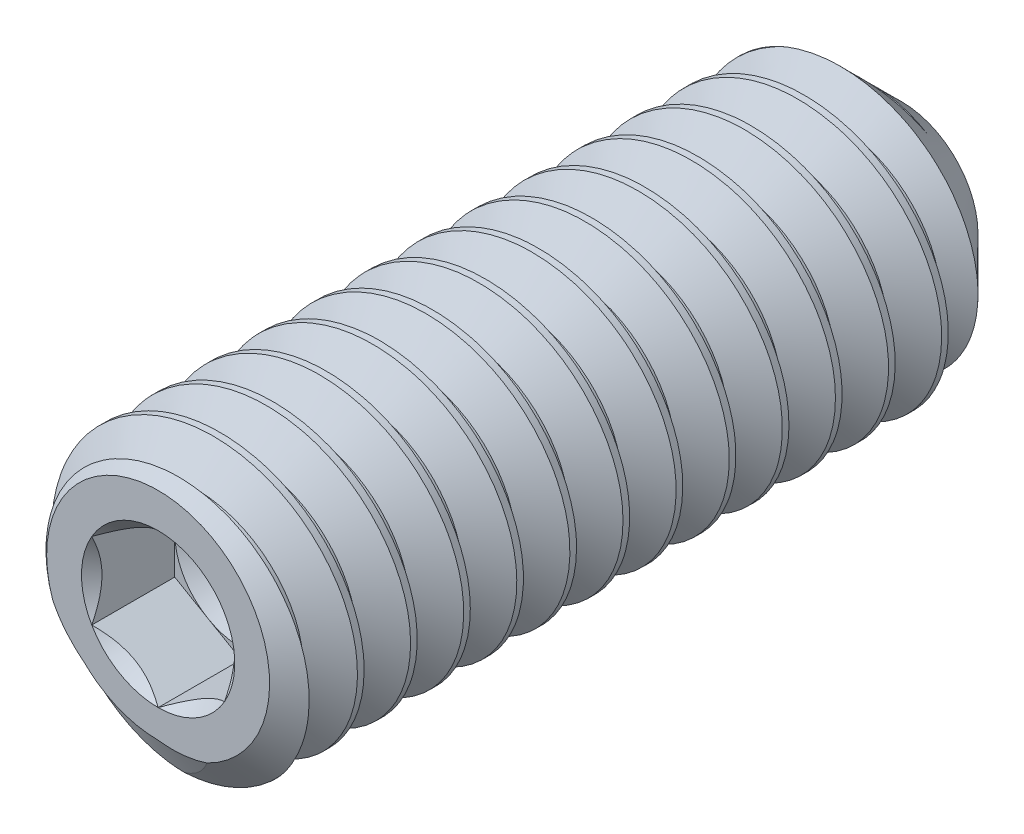
from build123d import *

# Parameters (mm, degrees)
CUT_EXTRUDE10_DEPTH = 1.240234375
CUT_SWEEP1_PITCH    = 0.79375


with BuildPart() as part:
    # Sketch22 → Revolve1 (revolve)
    with BuildSketch(Plane(origin=(0, 0, 0), x_dir=(0, 0, -1), z_dir=(1, 0, 0)), mode=Mode.PRIVATE) as revolve1_sk:
        Polygon((-5.213368495, 0), (-5.213368495, 1.66624), (-4.921690043, 2.0828), (4.957632812, 2.0828), (5.899131505, 1.141301307), (5.213368495, 0), align=None)
    revolve(revolve1_sk.sketch.rotate(Axis((0, 0, -5.213368495), (0, 0, -1)), 180), axis=Axis((0, 0, -5.213368495), (0, 0, -1)))

    # Sketch23 → Cut-Extrude10 (cut)
    with BuildSketch(Plane.XY.offset(5.213368495)):
        Polygon((0, 1.14567944), (-0.9921875, 0.57283972), (-0.9921875, -0.57283972), (0, -1.14567944), (0.9921875, -0.57283972), (0.9921875, 0.57283972), align=None)
    extrude(amount=-CUT_EXTRUDE10_DEPTH, mode=Mode.SUBTRACT)

    # Cut-Extrude11 cone 1 section (through the dimple's axis) → Cut-Extrude11 (revolve, cut)
    with BuildSketch(Plane(origin=(0, 0, 5.213368495), x_dir=(0, -1, 0), z_dir=(1, 0, 0))):
        Polygon((0, 0), (1.14567944, 0), (0, 1.14567944), align=None)
    revolve(axis=Axis((0, 0, 5.213368495), (0, 0, -1)), mode=Mode.SUBTRACT)

    # Cut-Extrude12 cone 1 section (through the dimple's axis) → Cut-Extrude12 (revolve, cut)
    with BuildSketch(Plane(origin=(0, 0, 3.97313412), x_dir=(0, -1, 0), z_dir=(1, 0, 0))):
        Polygon((0, 0), (0.9921875, 0), (0, 0.57283972), align=None)
    revolve(axis=Axis((0, 0, 3.97313412), (0, 0, -1)), mode=Mode.SUBTRACT)

    # Cut-Sweep1: the profile of Sketch32 screwed along a right-hand helix of 15 turns, 8 arcs to a turn; built about Z, then put on its axis
    cut_sweep1_z = Axis((0, 0, 0), (0, 0, 1))
    cut_sweep1_corners = [(1.567244252, 0, -0.29765625), (1.567244252, 0, -0.396875), (2.125762979, 0, -0.719335938), (2.125762979, 0, 0.024804688)]
    with BuildLine(mode=Mode.PRIVATE) as cut_sweep1_profile:
        Line(cut_sweep1_corners[0], cut_sweep1_corners[1])
        Line(cut_sweep1_corners[1], cut_sweep1_corners[2])
        Line(cut_sweep1_corners[2], cut_sweep1_corners[3])
        Line(cut_sweep1_corners[3], cut_sweep1_corners[0])
    cut_sweep1_cap = Face(cut_sweep1_profile.wire())
    cut_sweep1_turn_angles = [0, 22.5, 45, 67.5, 90, 112.5, 135, 157.5, 180, 202.5, 225, 247.5, 270, 292.5, 315, 337.5, 360]
    cut_sweep1_turn_weights = [1, 0.9238795325112867, 1, 0.9238795325112867, 1, 0.9238795325112867, 1, 0.9238795325112867, 1, 0.9238795325112867, 1, 0.9238795325112867, 1, 0.9238795325112867, 1, 0.9238795325112867, 1]
    cut_sweep1_turn_rails = [Edge.make_bspline([Vector(p[0], p[1], 0).rotate(cut_sweep1_z, cut_sweep1_turn_angles[k]) / cut_sweep1_turn_weights[k] + Vector(0, 0, p[2] + CUT_SWEEP1_PITCH * cut_sweep1_turn_angles[k] / 360) for k in range(17)], [0, 0, 0, 1, 1, 2, 2, 3, 3, 4, 4, 5, 5, 6, 6, 7, 7, 8, 8, 8], 2, cut_sweep1_turn_weights) for p in cut_sweep1_corners]
    cut_sweep1_turn_sides = [Face.make_surface_from_curves(cut_sweep1_turn_rails[p[0]], cut_sweep1_turn_rails[p[1]]) for p in [(0, 1), (1, 2), (2, 3), (3, 0)]]
    cut_sweep1 = Plane(origin=(0, 0, -5.899131505), x_dir=(0, 1, 0), z_dir=(0, 0, 1)) * Solid(Shell([*[p.moved(Location((0, 0, CUT_SWEEP1_PITCH * i))) for i in range(15) for p in cut_sweep1_turn_sides], cut_sweep1_cap, cut_sweep1_cap.rotate(cut_sweep1_z, 5400).moved(Location((0, 0, CUT_SWEEP1_PITCH * 5400 / 360)))]))
    add(cut_sweep1, mode=Mode.SUBTRACT)


solid = part.part
